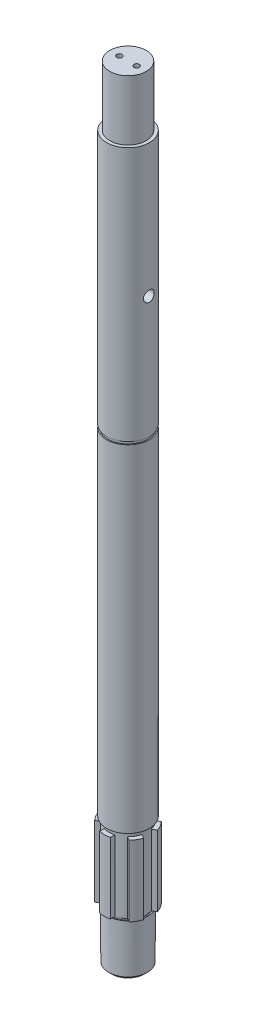
from build123d import *

# Parameters (mm, degrees)
EXTRUDE_1_DEPTH          = 90
EXTRUDE_1_DEPTH_BACK     = 250
SKETCH_1_R               = 10
CUT_EXTRUDE_1_DEPTH      = 251.399680511
CUT_EXTRUDE_1_DEPTH_BACK = 251.399680511
SKETCH_2_R               = 2.5
CHAMFER_1_SIZE           = 1
CUT_EXTRUDE_START        = -58
SKETCH_3_OUTSIDE_W       = 90.234
SKETCH_3_OUTSIDE_H       = 90.234
SKETCH_3_OUTSIDE_R       = 9.5
CUT_EXTRUDE_2_DEPTH      = 1.3
SKETCH_4_OUTSIDE_W       = 90.234
SKETCH_4_OUTSIDE_H       = 90.234
SKETCH_4_OUTSIDE_R       = 8.5
CUT_EXTRUDE_3_DEPTH      = 28
HOLE_WIZARD_M3_1_D       = 2.5
HOLE_WIZARD_M3_1_DEPTH   = 16.748924226
HOLE_WIZARD_M3_1_TIP     = 0.751075774
SKETCH_12_OUTSIDE_W      = 90.234
SKETCH_12_OUTSIDE_H      = 90.234
SKETCH_12_OUTSIDE_R      = 9
CUT_EXTRUDE_4_DEPTH      = 33
EXTRUDE_2_DEPTH          = 33
PATTERN_CIRCULAR_1_COUNT = 6
SKETCH_14_OUTSIDE_W      = 91.326
SKETCH_14_OUTSIDE_H      = 92.272
SKETCH_14_OUTSIDE_R      = 9
CUT_EXTRUDE_5_DEPTH      = 2
EXTRUDE_START            = 25
SKETCH_15_R              = 9
EXTRUDE_3_DEPTH          = 25
CUT_EXTRUDE_START_2      = -25
SKETCH_16_OUTSIDE_W      = 96.308
SKETCH_16_OUTSIDE_H      = 97.254
SKETCH_16_OUTSIDE_R      = 8.5
CUT_EXTRUDE_6_DEPTH      = 1


# Read off the part's stored shape, not the designer's step: M18 机械螺纹 螺柱1
with BuildPart() as part:
    # 草图1 → 凸台-拉伸1 (new, two sides: drawn at the far end of the back side and taken through both)
    with BuildSketch(Plane(origin=(0, 0, 0), x_dir=(1, 0, 0), z_dir=(0, 1, 0)).offset(-EXTRUDE_1_DEPTH_BACK)):
        with Locations(Location((0, 0, 0), (0, 0, 90))):
            Circle(SKETCH_1_R)
    extrude(amount=EXTRUDE_1_DEPTH + EXTRUDE_1_DEPTH_BACK)

    # 草图2 → 切除-拉伸1 (cut, two sides: drawn at the far end of the back side and taken through both)
    with BuildSketch(Plane(origin=(0, 0, 0), x_dir=(0, 0, -1), z_dir=(1, 0, 0)).offset(-CUT_EXTRUDE_1_DEPTH_BACK)):
        Circle(SKETCH_2_R)
    extrude(amount=CUT_EXTRUDE_1_DEPTH + CUT_EXTRUDE_1_DEPTH_BACK, mode=Mode.SUBTRACT)

    # 倒角1
    chamfer_1_edges = [part.edges().sort_by_distance(p)[0] for p in [
        (0, 90, 10),
    ]]
    chamfer(chamfer_1_edges, length=CHAMFER_1_SIZE)

    # 草图3 outside → 切除-拉伸2 (cut)
    with BuildSketch(Plane(origin=(0, 0, 0), x_dir=(1, 0, 0), z_dir=(0, 1, 0)).offset(CUT_EXTRUDE_START)):
        Rectangle(SKETCH_3_OUTSIDE_W, SKETCH_3_OUTSIDE_H)
        with Locations(Location((0, 0, 0), (0, 0, 270))):
            Circle(SKETCH_3_OUTSIDE_R, mode=Mode.SUBTRACT)
    extrude(amount=CUT_EXTRUDE_2_DEPTH, mode=Mode.SUBTRACT)

    # 草图4 outside → 切除-拉伸3 (cut)
    with BuildSketch(Plane(origin=(0, 90, 0), x_dir=(1, 0, 0), z_dir=(0, 1, 0))):
        Rectangle(SKETCH_4_OUTSIDE_W, SKETCH_4_OUTSIDE_H)
        with Locations(Location((0, 0, 0), (0, 0, 270))):
            Circle(SKETCH_4_OUTSIDE_R, mode=Mode.SUBTRACT)
    extrude(amount=-CUT_EXTRUDE_3_DEPTH, mode=Mode.SUBTRACT)

    # M3 螺纹孔1
    with Locations(Plane(origin=(0, 90, 0), x_dir=(1, 0, 0), z_dir=(0, 1, 0))):
        with Locations((4, 0), (-4, 0)):
            Hole(HOLE_WIZARD_M3_1_D / 2, depth=HOLE_WIZARD_M3_1_DEPTH)
            with Locations((0, 0, -(HOLE_WIZARD_M3_1_DEPTH + HOLE_WIZARD_M3_1_TIP / 2))):  # 118° drill point
                Cone(0, HOLE_WIZARD_M3_1_D / 2, HOLE_WIZARD_M3_1_TIP, mode=Mode.SUBTRACT)

    # 草图12 outside → 切除-拉伸4 (cut)
    with BuildSketch(Plane.XZ.offset(250)):
        Rectangle(SKETCH_12_OUTSIDE_W, SKETCH_12_OUTSIDE_H)
        with Locations(Location((0, 0, 0), (0, 0, 270))):
            Circle(SKETCH_12_OUTSIDE_R, mode=Mode.SUBTRACT)
    extrude(amount=-CUT_EXTRUDE_4_DEPTH, mode=Mode.SUBTRACT)

    # 草图13 → 凸台-拉伸2 (add)
    with BuildSketch(Plane.XZ.offset(250)):
        with BuildLine():
            Line((-2.5, -10.712142643), (-2.5, 10.712142643))
            ThreePointArc((-2.5, 10.712142643), (0, 11), (2.5, 10.712142643))
            Line((2.5, 10.712142643), (2.5, -10.712142643))
            ThreePointArc((2.5, -10.712142643), (0, -11), (-2.5, -10.712142643))
        make_face()
    extrude_2 = extrude(amount=-EXTRUDE_2_DEPTH)

    # 阵列(圆周)1: 凸台-拉伸2 ×6 about axis
    pattern_circular_1_axis = Axis((0, 0, 0), (0, 1, 0))
    for i in range(1, PATTERN_CIRCULAR_1_COUNT):
        add(extrude_2.rotate(pattern_circular_1_axis, i * 360 / PATTERN_CIRCULAR_1_COUNT))

    # 草图14 outside → 切除-拉伸5 (cut)
    with BuildSketch(Plane.XZ.offset(217)):
        Rectangle(SKETCH_14_OUTSIDE_W, SKETCH_14_OUTSIDE_H)
        with Locations(Location((0, 0, 0), (0, 0, 270))):
            Circle(SKETCH_14_OUTSIDE_R, mode=Mode.SUBTRACT)
    extrude(amount=-CUT_EXTRUDE_5_DEPTH, mode=Mode.SUBTRACT)

    # 草图15 → 凸台-拉伸3 (add)
    with BuildSketch(Plane.XZ.offset(250).offset(EXTRUDE_START)):
        with Locations(Location((0, 0, 0), (0, 0, 270))):
            Circle(SKETCH_15_R)
    extrude(amount=-EXTRUDE_3_DEPTH)

    # 草图16 outside → 切除-拉伸6 (cut)
    with BuildSketch(Plane.XZ.offset(275).offset(CUT_EXTRUDE_START_2)):
        Rectangle(SKETCH_16_OUTSIDE_W, SKETCH_16_OUTSIDE_H)
        with Locations(Location((0, 0, 0), (0, 0, 90))):
            Circle(SKETCH_16_OUTSIDE_R, mode=Mode.SUBTRACT)
    extrude(amount=CUT_EXTRUDE_6_DEPTH, mode=Mode.SUBTRACT)

    # M18 机械螺纹 螺柱1 outline → M18 机械螺纹 螺柱1 (revolve, cut)
    with BuildSketch(Plane.XY):
        Polygon((9, -273.647), (7.647, -275), (9, -275), align=None)
    revolve(axis=Axis((0, 0, 0), (0, 1, 0)), mode=Mode.SUBTRACT)


solid = part.part
